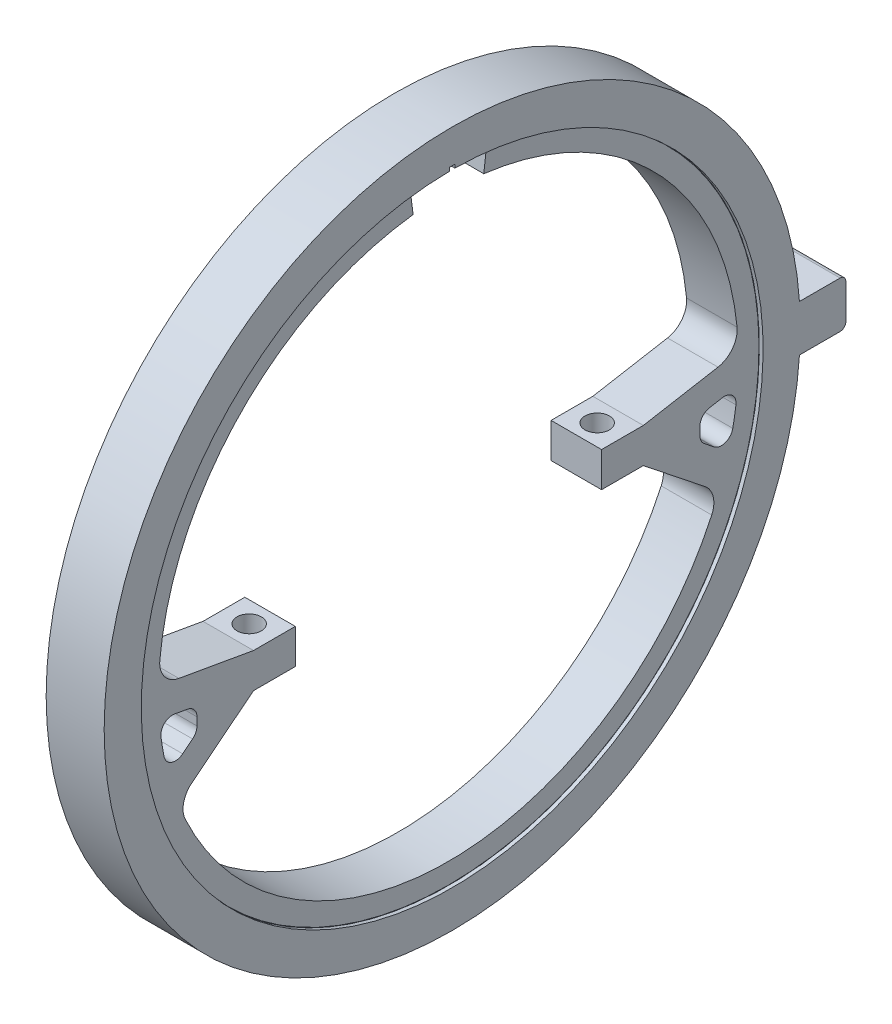
from build123d import *

# Parameters (mm, degrees)
REVOLVE2_ANGLE      = 173
BOSS_EXTRUDE1_START = -2.176469
BOSS_EXTRUDE1_DEPTH = 4.352938
FILLET1_R           = 2
FILLET2_R           = 1
CUT_EXTRUDE1_REACH  = 44.5
SKETCH4_R           = 1.05
SKETCH5_W           = 4
SKETCH5_H           = 4
BOSS_EXTRUDE2_DEPTH = 2.5
FILLET3_R           = 0.5
CUT_REVOLVE2_ANGLE  = 1


# Read off the part's stored shape, not the designer's step: Revolve2
with BuildPart() as part:
    # Sketch2 → Revolve1 (revolve)
    with BuildSketch(Plane(origin=(0, 0, 0), x_dir=(1, 0, 0), z_dir=(0, 1, 0)), mode=Mode.PRIVATE) as revolve1_sk:
        Polygon((-0.75, 28.5), (0, 28.5), (0, 30), (-2.5, 30), (-2.5, 26.8), (-2.176469373, 26.8), align=None)
    revolve1 = revolve(revolve1_sk.sketch.rotate(Axis((0, 0, 0), (1, 0, 0)), 180), axis=Axis((0, 0, 0), (1, 0, 0)))


with BuildPart() as body_2:
    # Revolve2 outline → Revolve2 (revolve)
    with BuildSketch(Plane(origin=(0, 0, 0), x_dir=(0, -1, 0), z_dir=(0, 0, 1))):
        Polygon((25, 0), (25, -2.176469373), (26.77, -2.176469373), (26.77, -2.175534216), (28.47, -0.749064843), (28.47, 0), align=None)
    revolve2 = revolve(axis=Axis((0, 0, 0), (1, 0, 0)), revolution_arc=REVOLVE2_ANGLE)


with BuildPart() as part_1:
    add(part.part)

    add(body_2.part)  # Mirror1 merges body 2
    # Mirror1: Revolve1, Revolve2 across plane
    add(revolve1.mirror(Plane(origin=(0, 0, 0), x_dir=(0, 0, 1), z_dir=(1, 0, 0))))
    add(revolve2.mirror(Plane(origin=(0, 0, 0), x_dir=(0, 0, 1), z_dir=(1, 0, 0))))

    # Sketch3 → Boss-Extrude1 (add)
    with BuildSketch(Plane(origin=(0, 0, 0), x_dir=(0, 0, -1), z_dir=(1, 0, 0)).offset(BOSS_EXTRUDE1_START)):
        with BuildLine():
            Line((24.992927205, 0.594634117), (16.8, -0.85))
            Line((16.8, -0.85), (13.2, -0.85))
            Line((13.2, -0.85), (13.2, -3.85))
            Line((13.2, -3.85), (16.8, -3.85))
            Line((16.8, -3.85), (23.314414659, -9.024304356))
            ThreePointArc((23.314414659, -9.024304356), (23.762509208, -7.768085746), (24.142970944, -6.489757623))
            Line((24.142970944, -6.489757623), (21.674472629, -4.529065489))
            Line((21.674472629, -4.529065489), (21.674472629, -2.529065489))
            Line((21.674472629, -2.529065489), (24.923348035, -1.956201097))
            ThreePointArc((24.923348035, -1.956201097), (24.990704742, -0.681671824), (24.992927205, 0.594634117))
        make_face()
    extrude(amount=BOSS_EXTRUDE1_DEPTH)

    # Fillet1
    # the kernel refuses this fillet: 2 mm, written as the material it adds along each edge
    with BuildSketch(Plane(origin=(-6.825018134, 0.594634117, -24.992927205), x_dir=(0, 0.9981410168670989, 0.06094678373395691), z_dir=(1, 0, 0))) as fillet1_piece_1_section:
        with BuildLine():
            CenterArc((1.785042868, 1.998616545), FILLET1_R, 186.505841055, 85.625388348)
            Line((-0.202077752, 1.772007538), (0, 0))
            ThreePointArc((0, 0), (0.929709827, -0.017293188), (1.859419654, 0))
        make_face()
    fillet1_piece_1 = extrude(amount=13.650036268, mode=Mode.PRIVATE)
    fillet1_piece_1 = split(fillet1_piece_1, bisect_by=Plane(origin=(-2.176469373, 0.943690029, -24.587007533), z_dir=(1, 0, 0)), keep=Keep.TOP, mode=Mode.PRIVATE)
    fillet1_piece_1 = split(fillet1_piece_1, bisect_by=Plane(origin=(2.176469373, 0.943690029, -24.587007533), z_dir=(-1, 0, 0)), keep=Keep.TOP, mode=Mode.PRIVATE)
    add(fillet1_piece_1)
    with BuildSketch(Plane(origin=(-6.138912646, -9.024304356, -23.314414659), x_dir=(0, -0.9206652582937424, 0.39035302249491644), z_dir=(1, 0, 0))) as fillet1_piece_2_section:
        with BuildLine():
            CenterArc((1.52157836, -1.998994886), FILLET1_R, 88.183445303, 76.333419365)
            Line((-0.405839783, -1.465085435), (0, 0))
            ThreePointArc((0, 0), (0.792488729, 0.012563925), (1.584977458, 0))
        make_face()
    fillet1_piece_2 = extrude(amount=12.277825292, mode=Mode.PRIVATE)
    fillet1_piece_2 = split(fillet1_piece_2, bisect_by=Plane(origin=(-2.176469373, -9.144329866, -22.922792538), z_dir=(1, 0, 0)), keep=Keep.TOP, mode=Mode.PRIVATE)
    fillet1_piece_2 = split(fillet1_piece_2, bisect_by=Plane(origin=(2.176469373, -9.144329866, -22.922792538), z_dir=(-1, 0, 0)), keep=Keep.TOP, mode=Mode.PRIVATE)
    add(fillet1_piece_2)

    # Fillet2
    fillet2_edges = [part_1.edges().sort_by_distance(p)[0] for p in [
        (0, -1.956201097, -24.923348035),
        (0, -2.529065489, -21.674472629),
        (0, -4.529065489, -21.674472629),
        (0, -6.489757623, -24.142970944),
    ]]
    fillet(fillet2_edges, radius=FILLET2_R)

    # Sketch4 → Cut-Extrude1 (cut, up to next)
    with BuildSketch(Plane(origin=(0, 0, 0), x_dir=(1, 0, 0), z_dir=(0, 1, 0)), mode=Mode.PRIVATE) as cut_extrude1_sk1:
        with Locations(Location((0, 15, 0), (0, 0, 270))):
            Circle(SKETCH4_R)
    cut_extrude1_tool1 = extrude(cut_extrude1_sk1.sketch, amount=-CUT_EXTRUDE1_REACH, mode=Mode.PRIVATE) & part_1.part
    add(cut_extrude1_tool1.solids().sort_by_distance((0, 0, -15))[0], mode=Mode.SUBTRACT)

    # Mirror2: part across plane


with BuildPart() as part_2:
    add(part_1.part)
    add(part_1.part.mirror(Plane.XY))

    # Sketch5 → Boss-Extrude2 (add, symmetric)
    with BuildSketch(Plane(origin=(0, 0, 0), x_dir=(0, 0, -1), z_dir=(1, 0, 0))):
        with Locations((31.933259094, 0)):
            Rectangle(SKETCH5_W, SKETCH5_H)
    extrude(amount=BOSS_EXTRUDE2_DEPTH, both=True)

    # Fillet3
    fillet3_edges = [part_2.edges().sort_by_distance(p)[0] for p in [
        (0, 2, -33.933259094),
        (0, -2, -33.933259094),
    ]]
    fillet(fillet3_edges, radius=FILLET3_R)

    # Sketch6 → Cut-Revolve2 (revolve, symmetric, cut)
    with BuildSketch(Plane.XY) as cut_revolve2_sk:
        Polygon((2.5, 27.1), (2.31636167, 27.1), (0.889892297, 28.8), (-0.889892297, 28.8), (-2.31636167, 27.1), (-2.5, 27.1), (-2.5, 26.8), (-2.176469373, 26.8), (-0.75, 28.5), (0.75, 28.5), (2.176469373, 26.8), (2.5, 26.8), align=None)
    revolve(axis=Axis((0, 0, 0), (1, 0, 0)), revolution_arc=CUT_REVOLVE2_ANGLE / 2, mode=Mode.SUBTRACT)
    revolve(cut_revolve2_sk.sketch, axis=Axis((0, 0, 0), (-1, 0, 0)), revolution_arc=CUT_REVOLVE2_ANGLE / 2, mode=Mode.SUBTRACT)


solid = part_2.part
